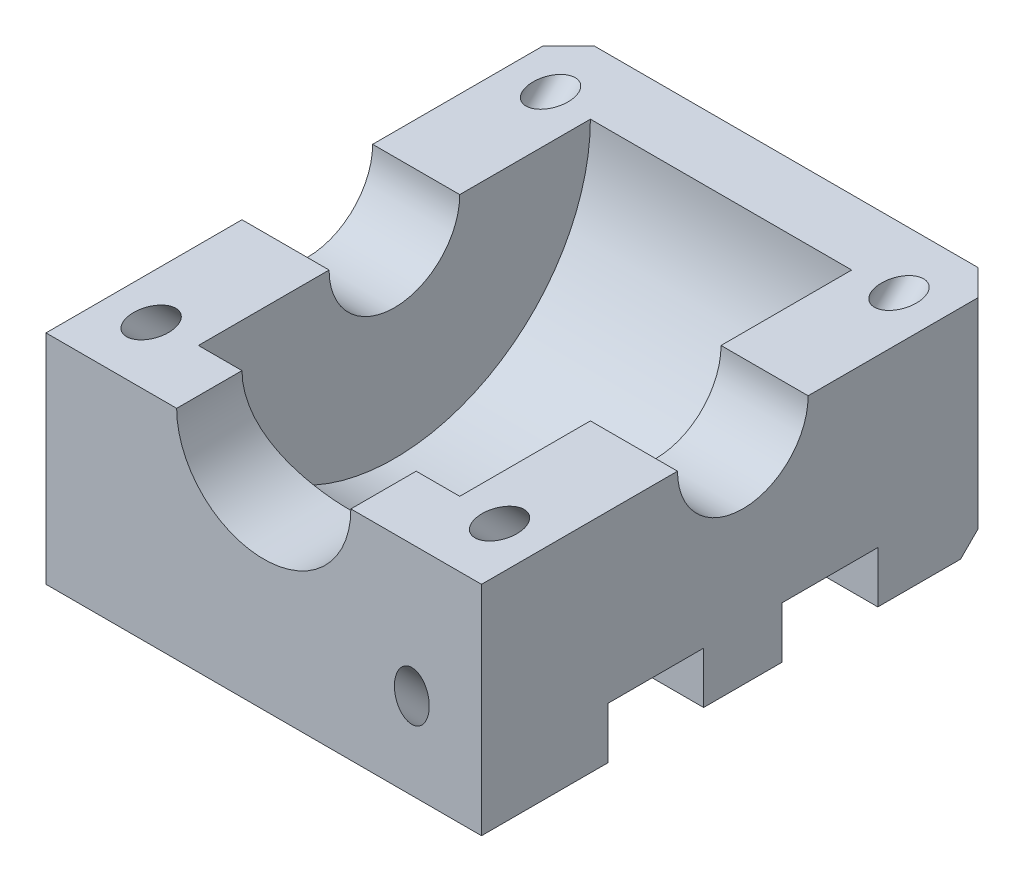
from build123d import *

# Parameters (mm, degrees)
SKETCH1_W                = 50
SKETCH1_H                = 60
BOSS_EXTRUDE1_DEPTH      = 25
CUT_EXTRUDE1_START       = -10
SKETCH2_R                = 22.5
CUT_EXTRUDE1_DEPTH       = 30
SKETCH3_R                = 7.5
CUT_EXTRUDE2_DEPTH       = 64.442887702
SKETCH4_R                = 10
CUT_EXTRUDE3_DEPTH       = 10
SKETCH5_R                = 1.75
CUT_EXTRUDE4_DEPTH       = 10
CHAMFER1_SIZE            = 5
SKETCH6_R                = 2
CUT_EXTRUDE5_DEPTH       = 10
SKETCH7_W                = 11
SKETCH7_H                = 5.906734889
CUT_EXTRUDE6_DEPTH       = 9
CHAMFER2_SIZE            = 5
CHAMFER2_OF_MIRROR1_SIZE = 5
CHAMFER3_SIZE            = 3
CUT_EXTRUDE8_START       = 25
SKETCH10_R               = 2
CUT_EXTRUDE8_DEPTH       = 25.371044267
SKETCH11_R               = 2
CUT_EXTRUDE9_DEPTH       = 50.371044267


with BuildPart() as part:
    # Sketch1 → Boss-Extrude1 (new body)
    with BuildSketch(Plane(origin=(0, 0, 0), x_dir=(1, 0, 0), z_dir=(0, 1, 0))):
        Rectangle(SKETCH1_W, SKETCH1_H)
    extrude(amount=BOSS_EXTRUDE1_DEPTH)

    # Sketch2 → Cut-Extrude1 (cut)
    with BuildSketch(Plane.ZY.offset(25).offset(CUT_EXTRUDE1_START)):
        with Locations((0, 25)):
            Circle(SKETCH2_R)
    extrude(amount=-CUT_EXTRUDE1_DEPTH, mode=Mode.SUBTRACT)

    # Sketch3 → Cut-Extrude2 (cut, through all)
    with BuildSketch(Plane.ZY.offset(25)):
        with Locations((0, 25)):
            Circle(SKETCH3_R)
    extrude(amount=-CUT_EXTRUDE2_DEPTH, mode=Mode.SUBTRACT)

    # Sketch4 → Cut-Extrude3 (cut)
    with BuildSketch(Plane.XY.offset(30)):
        with Locations((0, 25)):
            Circle(SKETCH4_R)
    extrude(amount=-CUT_EXTRUDE3_DEPTH, mode=Mode.SUBTRACT)

    # Sketch5 → Cut-Extrude4 (cut)
    with BuildSketch(Plane.XZ):
        with Locations(Location((-10, 20, 0), (0, 0, 270))):
            Circle(SKETCH5_R)
        with Locations(Location((10, 20, 0), (0, 0, 270))):
            Circle(SKETCH5_R)
        with Locations(Location((-10, -20, 0), (0, 0, 270))):
            Circle(SKETCH5_R)
        with Locations(Location((10, -20, 0), (0, 0, 270))):
            Circle(SKETCH5_R)
    extrude(amount=-CUT_EXTRUDE4_DEPTH, mode=Mode.SUBTRACT)

    # Chamfer1
    chamfer1_edges = [part.edges().sort_by_distance(p)[0] for p in [
        (0, 0, -30),
    ]]
    chamfer(chamfer1_edges, length=CHAMFER1_SIZE)

    # Sketch6 → Cut-Extrude5 (cut)
    with BuildSketch(Plane(origin=(0, 0, -30), x_dir=(-1, 0, 0), z_dir=(0, 0, -1))):
        with Locations((-20, 15)):
            Circle(SKETCH6_R)
        with Locations((20, 15)):
            Circle(SKETCH6_R)
    extrude(amount=-CUT_EXTRUDE5_DEPTH, mode=Mode.SUBTRACT)

    # Sketch7 → Cut-Extrude6 (cut)
    with BuildSketch(Plane(origin=(25, 0, 0), x_dir=(0, 0, -1), z_dir=(1, 0, 0))):
        with Locations((-10, 2.953367444)):
            Rectangle(SKETCH7_W, SKETCH7_H)
        with Locations((10, 2.953367444)):
            Rectangle(SKETCH7_W, SKETCH7_H)
    cut_extrude6 = extrude(amount=-CUT_EXTRUDE6_DEPTH, mode=Mode.SUBTRACT)

    # Chamfer2
    chamfer2_edges = [part.edges().sort_by_distance(p)[0] for p in [
        (16, 5.906734889, 10),
        (16, 5.906734889, -10),
    ]]
    chamfer(chamfer2_edges, length=CHAMFER2_SIZE)

    # Mirror1: Cut-Extrude6 across plane
    add(cut_extrude6.mirror(Plane(origin=(0, 0, 0), x_dir=(0, 0, 1), z_dir=(1, 0, 0))), mode=Mode.SUBTRACT)

    # Chamfer2 of Mirror1
    chamfer2_of_mirror1_edges = [part.edges().sort_by_distance(p)[0] for p in [
        (-16, 5.906734889, 10),
        (-16, 5.906734889, -10),
    ]]
    chamfer(chamfer2_of_mirror1_edges, length=CHAMFER2_OF_MIRROR1_SIZE)

    # Chamfer3
    chamfer3_edges = [part.edges().sort_by_distance(p)[0] for p in [
        (-25, 15, -30),
        (25, 15, -30),
    ]]
    chamfer(chamfer3_edges, length=CHAMFER3_SIZE - 0.0001)  # a hair under: the kernel refuses the full size

    # Sketch10 → Cut-Extrude8 (cut, through all)
    with BuildSketch(Plane(origin=(0, -2.5, -2.5), x_dir=(1, 0, 0), z_dir=(0, 0.7071067811865475, 0.7071067811865477)).offset(CUT_EXTRUDE8_START)):
        with Locations(Location((-20, 1.464466094, 0), (0, 0, 90))):
            Circle(SKETCH10_R)
        with Locations(Location((20, 1.464466094, 0), (0, 0, 90))):
            Circle(SKETCH10_R)
    cut_extrude8 = extrude(amount=CUT_EXTRUDE8_DEPTH, mode=Mode.SUBTRACT)

    # Mirror2: Cut-Extrude8 across plane
    add(cut_extrude8.mirror(Plane.XY), mode=Mode.SUBTRACT)

    # Sketch11 → Cut-Extrude9 (cut, through all)
    with BuildSketch(Plane(origin=(0, -2.5, -2.5), x_dir=(1, 0, 0), z_dir=(0, 0.7071067811865475, 0.7071067811865477))):
        with Locations(Location((17, -14.213203436, 0), (0, 0, 90))):
            Circle(SKETCH11_R)
    extrude(amount=CUT_EXTRUDE9_DEPTH, mode=Mode.SUBTRACT)


solid = part.part
